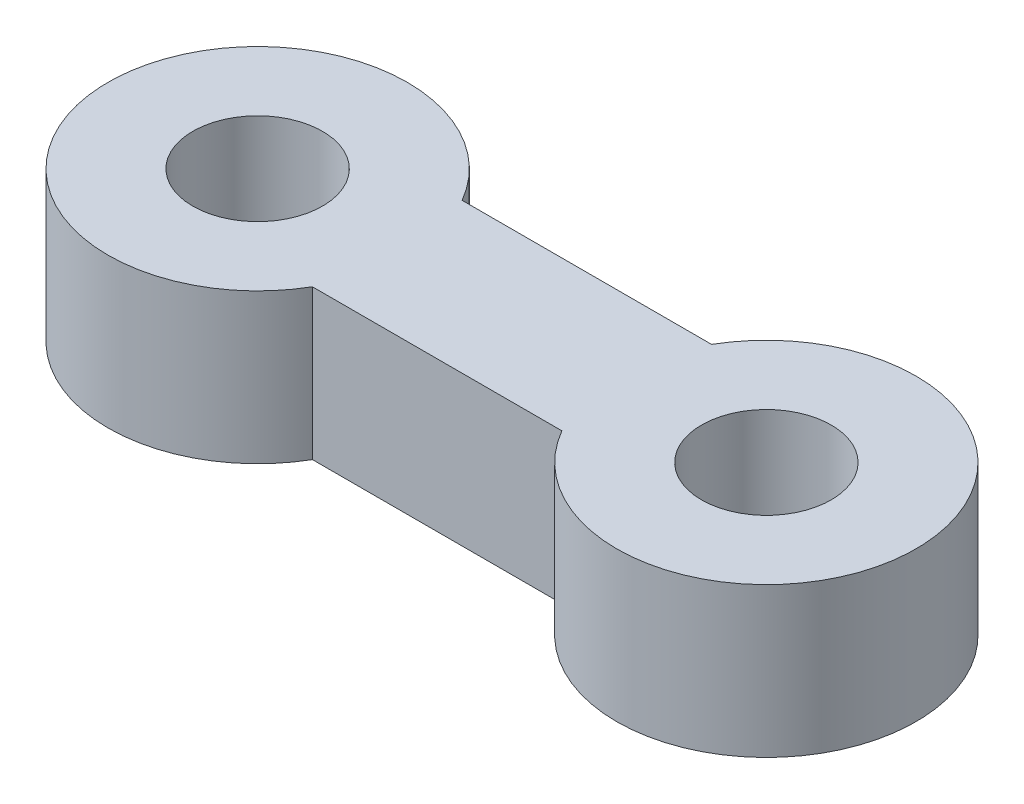
from build123d import *

# Parameters (mm, degrees)
SKETCH1_R           = 1.3
BOSS_EXTRUDE1_DEPTH = 3


with BuildPart() as part:
    # Sketch1 → Boss-Extrude1 (new body)
    with BuildSketch(Plane(origin=(0, 0, 0), x_dir=(1, 0, 0), z_dir=(0, 1, 0))):
        with BuildLine():
            Line((2.598076211, 1.5), (7.598076211, 1.5))
            ThreePointArc((7.598076211, 1.5), (13.196152423, 0), (7.598076211, -1.5))
            Line((7.598076211, -1.5), (2.598076211, -1.5))
            ThreePointArc((2.598076211, -1.5), (-3, 0), (2.598076211, 1.5))
        make_face()
        Circle(SKETCH1_R, mode=Mode.SUBTRACT)
        with Locations((10.196152423, 0)):
            Circle(SKETCH1_R, mode=Mode.SUBTRACT)
    extrude(amount=BOSS_EXTRUDE1_DEPTH)


solid = part.part
